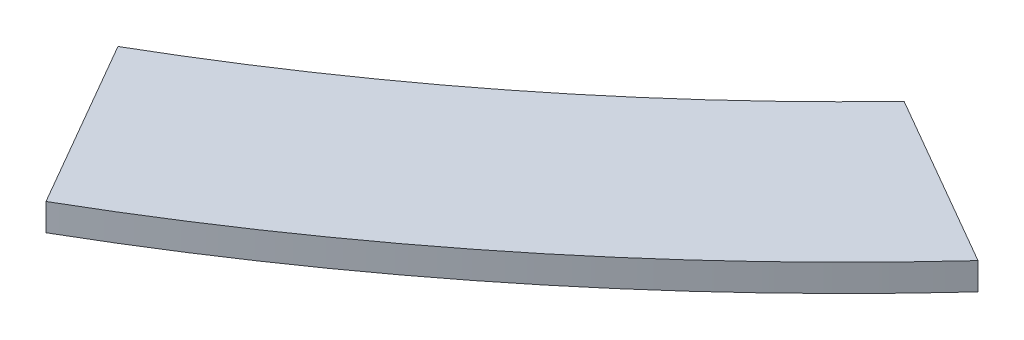
from build123d import *

# Parameters (mm, degrees)
BOSS_EXTRUDE1_DEPTH = 0.762


with BuildPart() as part:
    # Sketch1 → Boss-Extrude1 (new body)
    with BuildSketch(Plane(origin=(0, 0, 0), x_dir=(1, 0, 0), z_dir=(0, 1, 0))):
        with BuildLine():
            ThreePointArc((40.32786287, -38.681234163), (34.47763478, -43.975755821), (27.94, -48.393499563))
            Line((27.94, -48.393499563), (30.70225, -53.177856907))
            ThreePointArc((30.70225, -53.177856907), (38.416686562, -47.902722406), (45.241244894, -41.517976597))
            Line((45.241244894, -41.517976597), (40.32786287, -38.681234163))
        make_face()
    extrude(amount=BOSS_EXTRUDE1_DEPTH)


solid = part.part
